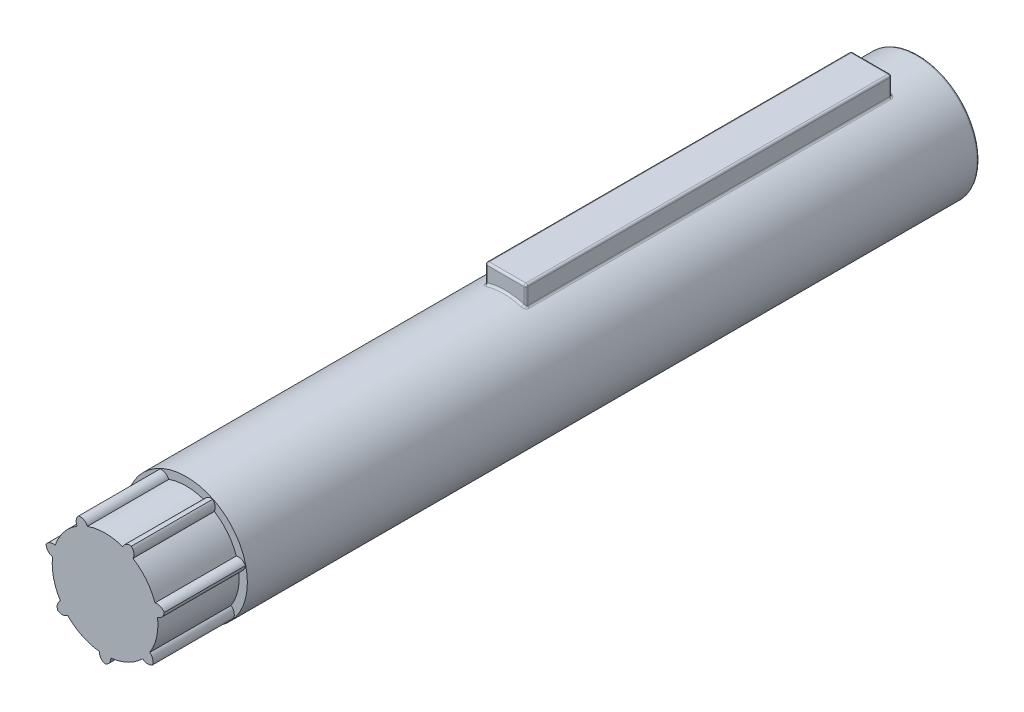
from build123d import *

# Parameters (mm, degrees)
SKETCH1_R                = 7.5
BOSS_EXTRUDE1_DEPTH      = 100
SKETCH2_W                = 5
SKETCH2_H                = 45
BOSS_EXTRUDE3_DEPTH      = 9.5
CUT_EXTRUDE1_START       = -10
CUT_EXTRUDE1_DEPTH       = 10
FILLET1_R                = 1
CIRPATTERN8_COUNT        = 7
FILLET1_OF_CIRPATTERN8_R = 1
FILLET3_R                = 0.25


with BuildPart() as part:
    # Sketch1 → Boss-Extrude1 (new body)
    with BuildSketch(Plane.XY):
        Circle(SKETCH1_R)
    extrude(amount=BOSS_EXTRUDE1_DEPTH)

    # Sketch2 → Boss-Extrude3 (add)
    with BuildSketch(Plane(origin=(0, 0, 0), x_dir=(1, 0, 0), z_dir=(0, 1, 0))):
        with Locations((0, -28.25)):
            Rectangle(SKETCH2_W, SKETCH2_H)
    extrude(amount=BOSS_EXTRUDE3_DEPTH)

    # Sketch3 → Cut-Extrude1 (cut)
    with BuildSketch(Plane.XY.offset(100).offset(CUT_EXTRUDE1_START)):
        with BuildLine():
            ThreePointArc((2.5, 7.071067812), (0, 7.5), (-2.5, 7.071067812))
            Line((-2.5, 7.071067812), (-2.166666667, 6.12825877))
            ThreePointArc((-2.166666667, 6.12825877), (0, 6.5), (2.166666667, 6.12825877))
            Line((2.166666667, 6.12825877), (2.5, 7.071067812))
        make_face()
    cut_extrude1 = extrude(amount=CUT_EXTRUDE1_DEPTH, mode=Mode.SUBTRACT)

    # Fillet1
    # the kernel refuses this fillet: 1 mm, written as the material it takes off along each edge
    with BuildSketch(Plane(origin=(2.5, 7.071067812, 90), x_dir=(0.9143745015294013, -0.4048694492708226, 0), z_dir=(0, 0, 1))) as fillet1_piece_1:
        with BuildLine():
            CenterArc((1.076923077, -0.997037031), FILLET1_R, 85.588274214, 94.411725786)
            Line((0.076923077, -0.997037031), (0.056923077, -0.997037031))
            ThreePointArc((0.056923077, -0.997037031), (0.018520798, -0.500056977), (-0.019940741, -0.001538462))
            Line((-0.019940741, -0.001538462), (-0.001538462, 0.019940741))
            ThreePointArc((-0.001538462, 0.019940741), (0.576923077, 0.042222271), (1.155384615, 0.019940741))
            Line((1.155384615, 0.019940741), (1.153846154, 0))
        make_face()
    extrude(amount=12.884615385, mode=Mode.SUBTRACT)
    with BuildSketch(Plane(origin=(-2.5, 7.071067812, 90), x_dir=(-0.9143745015294016, -0.40486944927082136, 0), z_dir=(0, 0, 1))) as fillet1_piece_2:
        with BuildLine():
            CenterArc((1.076923077, 0.997037031), FILLET1_R, 180, 94.411725786)
            Line((0.076923077, 0.997037031), (0.056923077, 0.997037031))
            ThreePointArc((0.056923077, 0.997037031), (0.018520798, 0.500056977), (-0.019940741, 0.001538462))
            Line((-0.019940741, 0.001538462), (-0.001538462, -0.019940741))
            ThreePointArc((-0.001538462, -0.019940741), (0.576923077, -0.042222271), (1.155384615, -0.019940741))
            Line((1.155384615, -0.019940741), (1.153846154, 0))
        make_face()
    extrude(amount=12.884615385, mode=Mode.SUBTRACT)

    # CirPattern8: Cut-Extrude1 ×7 about axis
    cirpattern8_axis = Axis((0, 0, 0), (0, 0, 1))
    for i in range(1, CIRPATTERN8_COUNT):
        add(cut_extrude1.rotate(cirpattern8_axis, i * 360 / CIRPATTERN8_COUNT), mode=Mode.SUBTRACT)

    # Fillet1 of CirPattern8
    # the kernel refuses this fillet: 1 mm, written as the material it takes off along each edge
    with BuildSketch(Plane(origin=(-3.969658925, 6.363317375, 90), x_dir=(0.8866428585126668, 0.4624547993571771, 0), z_dir=(0, 0, 1)), Plane(origin=(-7.450083714, 0.863859167, 90), x_dir=(0.19125105881764654, 0.9815411517104767, 0), z_dir=(0, 0, 1)), Plane(origin=(-5.320443512, -5.286102614, 90), x_dir=(-0.6481566889776921, 0.7615069970351391, 0), z_dir=(0, 0, 1)), Plane(origin=(0.815599172, -7.455521309, 90), x_dir=(-0.9994892299858744, -0.031957458319521785, 0), z_dir=(0, 0, 1)), Plane(origin=(6.337479044, -4.010780394, 90), x_dir=(-0.5981859949499692, -0.8013572957462329, 0), z_dir=(0, 0, 1)), Plane(origin=(7.087107935, 2.454159963, 90), x_dir=(0.25356349505382336, -0.9673187447662169, 0), z_dir=(0, 0, 1))) as fillet1_of_cirpattern8_piece_1:
        with BuildLine():
            CenterArc((1.076923077, -0.997037031), FILLET1_OF_CIRPATTERN8_R, 85.588274214, 94.411725786)
            Line((0.076923077, -0.997037031), (0.056923077, -0.997037031))
            ThreePointArc((0.056923077, -0.997037031), (0.018520798, -0.500056977), (-0.019940741, -0.001538462))
            Line((-0.019940741, -0.001538462), (-0.001538462, 0.019940741))
            ThreePointArc((-0.001538462, 0.019940741), (0.576923077, 0.042222271), (1.155384615, 0.019940741))
            Line((1.155384615, 0.019940741), (1.153846154, 0))
        make_face()
    extrude(amount=12.884615385, mode=Mode.SUBTRACT)
    with BuildSketch(Plane(origin=(-7.087107935, 2.454159963, 90), x_dir=(-0.25356349505382375, -0.9673187447662169, 0), z_dir=(0, 0, 1)), Plane(origin=(-6.337479044, -4.010780394, 90), x_dir=(0.5981859949499683, -0.8013572957462336, 0), z_dir=(0, 0, 1)), Plane(origin=(-0.815599172, -7.455521309, 90), x_dir=(0.9994892299858742, -0.03195745831952264, 0), z_dir=(0, 0, 1)), Plane(origin=(5.320443512, -5.286102614, 90), x_dir=(0.6481566889776939, 0.7615069970351375, 0), z_dir=(0, 0, 1)), Plane(origin=(7.450083714, 0.863859167, 90), x_dir=(-0.1912510588176455, 0.981541151710477, 0), z_dir=(0, 0, 1)), Plane(origin=(3.969658925, 6.363317375, 90), x_dir=(-0.8866428585126658, 0.46245479935717904, 0), z_dir=(0, 0, 1))) as fillet1_of_cirpattern8_piece_2:
        with BuildLine():
            CenterArc((1.076923077, 0.997037031), FILLET1_OF_CIRPATTERN8_R, 180, 94.411725786)
            Line((0.076923077, 0.997037031), (0.056923077, 0.997037031))
            ThreePointArc((0.056923077, 0.997037031), (0.018520798, 0.500056977), (-0.019940741, 0.001538462))
            Line((-0.019940741, 0.001538462), (-0.001538462, -0.019940741))
            ThreePointArc((-0.001538462, -0.019940741), (0.576923077, -0.042222271), (1.155384615, -0.019940741))
            Line((1.155384615, -0.019940741), (1.153846154, 0))
        make_face()
    extrude(amount=12.884615385, mode=Mode.SUBTRACT)

    # Fillet3
    fillet3_edges = [part.edges().sort_by_distance(p)[0] for p in [
        (0, 9.5, 50.75),
        (-2.5, 9.5, 28.25),
        (-7.5, 0, 0),
        (-2.5, 7.071067812, 28.25),
        (0, 7.5, 5.75),
        (2.5, 7.071067812, 28.25),
        (0, 7.5, 50.75),
        (2.5, 9.5, 28.25),
        (2.5, 8.285533906, 50.75),
        (-2.5, 8.285533906, 5.75),
        (-2.5, 8.285533906, 50.75),
        (0, 9.5, 5.75),
        (2.5, 8.285533906, 5.75),
    ]]
    fillet(fillet3_edges, radius=FILLET3_R)


solid = part.part
